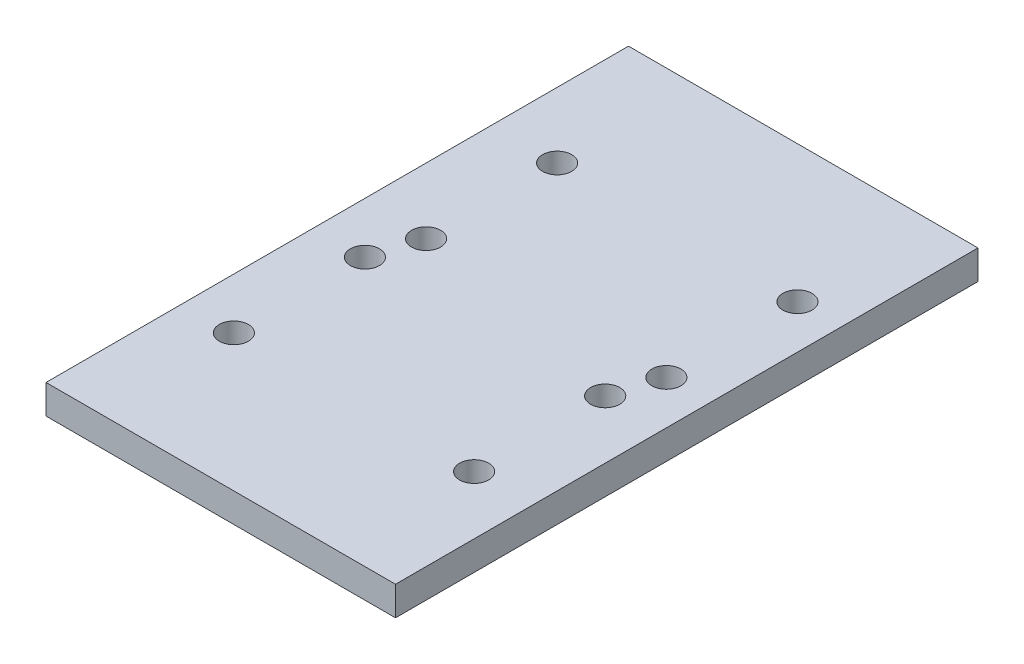
from build123d import *

# Parameters (mm, degrees)
CROQUIS1_W              = 48
CROQUIS1_H              = 4
SALIENTE_EXTRUIR1_DEPTH = 80
CROQUIS6_R              = 2
CORTAR_EXTRUIR4_DEPTH   = 84.618179841


with BuildPart() as part:
    # Croquis1 → Saliente-Extruir1 (new body)
    with BuildSketch(Plane.XY):
        Rectangle(CROQUIS1_W, CROQUIS1_H)
    extrude(amount=SALIENTE_EXTRUIR1_DEPTH)

    # Croquis6 → Cortar-Extruir4 (cut, through all)
    with BuildSketch(Plane.XZ.offset(2)):
        with Locations((16, 61.2)):
            Circle(CROQUIS6_R)
        with Locations((18, 36.8)):
            Circle(CROQUIS6_R)
        with Locations((18, 18.8)):
            Circle(CROQUIS6_R)
        with Locations((-17, 61.2)):
            Circle(CROQUIS6_R)
        with Locations((-15, 36.8)):
            Circle(CROQUIS6_R)
        with Locations((-15, 18.8)):
            Circle(CROQUIS6_R)
        with Locations((-17, 43.2)):
            Circle(CROQUIS6_R)
        with Locations((16, 43.2)):
            Circle(CROQUIS6_R)
    extrude(amount=-CORTAR_EXTRUIR4_DEPTH, mode=Mode.SUBTRACT)


solid = part.part
